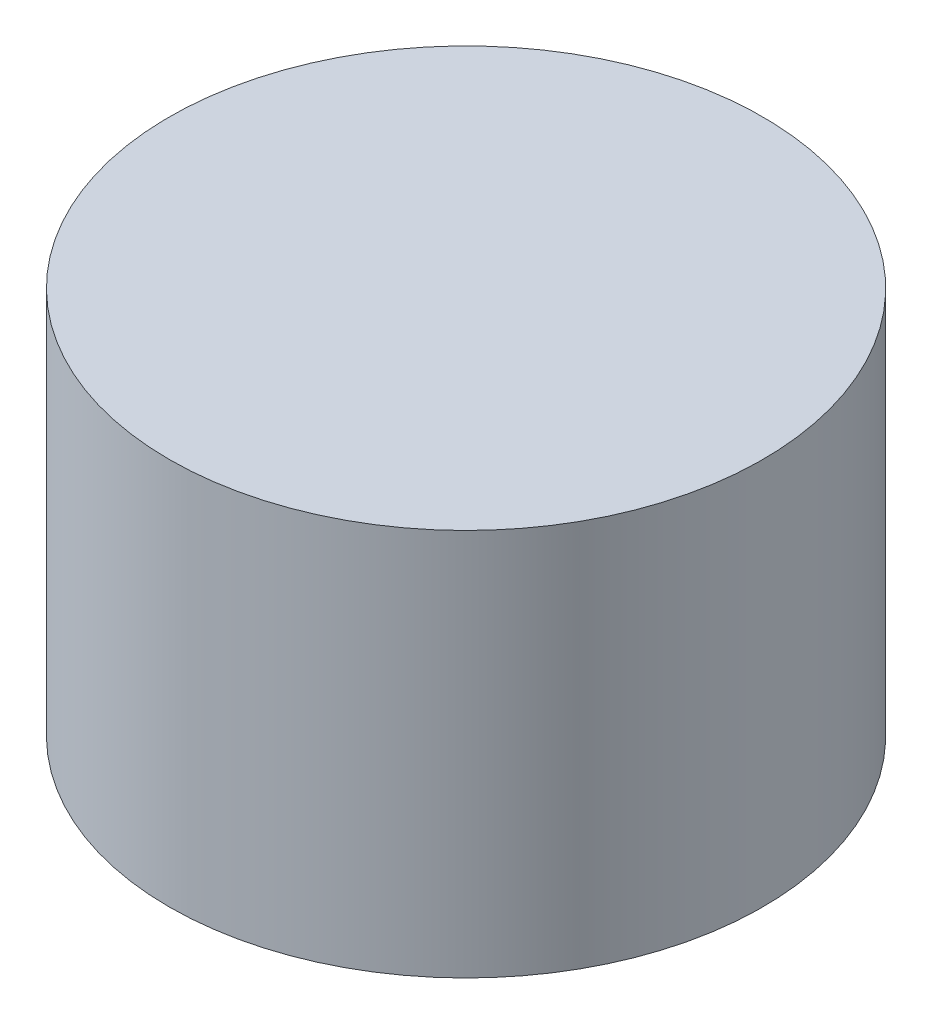
from build123d import *

# Parameters (mm, degrees)
SKETCH_1_R          = 49
EXTRUDE_1_DEPTH     = 64
CUT_EXTRUDE_START   = 16.5
SKETCH_1_3_R        = 35
CUT_EXTRUDE_1_DEPTH = 31


with BuildPart() as part:
    # 스케치1 → 보스-돌출1 (new body)
    with BuildSketch(Plane(origin=(0, 0, 0), x_dir=(1, 0, 0), z_dir=(0, 1, 0))):
        Circle(SKETCH_1_R)
    extrude(amount=EXTRUDE_1_DEPTH)

    # 스케치1<3> → 컷-돌출1 (cut)
    with BuildSketch(Plane(origin=(0, 0, 0), x_dir=(1, 0, 0), z_dir=(0, 1, 0)).offset(CUT_EXTRUDE_START)):
        Circle(SKETCH_1_3_R)
    extrude(amount=CUT_EXTRUDE_1_DEPTH, mode=Mode.SUBTRACT)


solid = part.part
